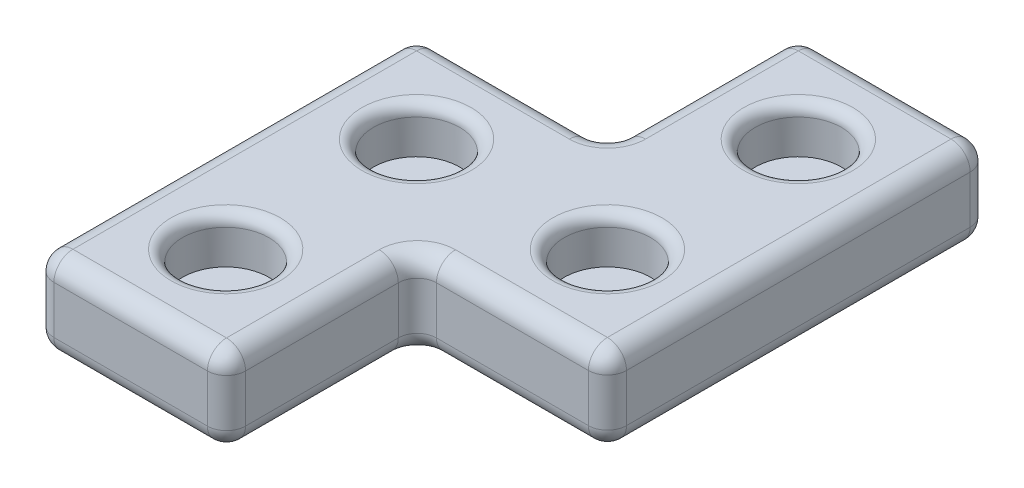
from build123d import *

# Parameters (mm, degrees)
BOSS_EXTRUDE1_DEPTH = 5.715
SKETCH2_R           = 2.8702
CUT_EXTRUDE1_DEPTH  = 3.048
FILLET1_R           = 1.27
FILLET2_R           = 1.27
FILLET3_R           = 0.762


with BuildPart() as part:
    # Sketch1 → Boss-Extrude1 (new body)
    with BuildSketch(Plane(origin=(0, 0, 0), x_dir=(1, 0, 0), z_dir=(0, 1, 0))):
        with BuildLine():
            Line((-7.665886605, 2.665075851), (-7.665886605, 12.825075851))
            ThreePointArc((-7.665886605, 12.825075851), (-7.293912217, 13.723101463), (-6.395886605, 14.095075851))
            Line((-6.395886605, 14.095075851), (3.764113395, 14.095075851))
            ThreePointArc((3.764113395, 14.095075851), (4.662139007, 13.723101463), (5.034113395, 12.825075851))
            Line((5.034113395, 12.825075851), (5.034113395, -10.034924149))
            ThreePointArc((5.034113395, -10.034924149), (4.662139007, -10.932949761), (3.764113395, -11.304924149))
            Line((3.764113395, -11.304924149), (-6.340896914, -11.304924149))
            ThreePointArc((-6.340896914, -11.304924149), (-7.238922526, -11.676898537), (-7.610896914, -12.574924149))
            Line((-7.610896914, -12.574924149), (-7.610896914, -22.734924149))
            ThreePointArc((-7.610896914, -22.734924149), (-7.982871302, -23.632949761), (-8.880896914, -24.004924149))
            Line((-8.880896914, -24.004924149), (-19.095886605, -24.004924149))
            ThreePointArc((-19.095886605, -24.004924149), (-19.993912217, -23.632949761), (-20.365886605, -22.734924149))
            Line((-20.365886605, -22.734924149), (-20.365886605, 0.125075851))
            ThreePointArc((-20.365886605, 0.125075851), (-19.993912217, 1.023101463), (-19.095886605, 1.395075851))
            Line((-19.095886605, 1.395075851), (-8.935886605, 1.395075851))
            ThreePointArc((-8.935886605, 1.395075851), (-8.037860993, 1.767050239), (-7.665886605, 2.665075851))
        make_face()
    extrude(amount=BOSS_EXTRUDE1_DEPTH)

    # Sketch2 → Cut-Extrude1 (cut)
    with BuildSketch(Plane(origin=(0, 5.715, 0), x_dir=(1, 0, 0), z_dir=(0, 1, 0))):
        with Locations((-1.315886605, 7.745075851)):
            Circle(SKETCH2_R)
        with Locations((-14.015886605, -4.954924149)):
            Circle(SKETCH2_R)
        with Locations((-14.015886605, -17.654924149)):
            Circle(SKETCH2_R)
        with Locations((-1.315886605, -4.954924149)):
            Circle(SKETCH2_R)
    extrude(amount=-CUT_EXTRUDE1_DEPTH, mode=Mode.SUBTRACT)

    # Fillet1
    fillet1_edges = [part.edges().sort_by_distance(p)[0] for p in [
        (-1.288391759, 5.715, 11.304924149),
        (-7.610896914, 5.715, 17.654924149),
        (-13.988391759, 5.715, 24.004924149),
        (-20.365886605, 5.715, 11.304924149),
        (-14.015886605, 5.715, -1.395075851),
        (-7.665886605, 5.715, -7.745075851),
        (-1.315886605, 5.715, -14.095075851),
        (5.034113395, 5.715, -1.395075851),
        (4.662139007, 5.715, 10.932949761),
        (-7.238922526, 5.715, 11.676898537),
        (-7.982871302, 5.715, 23.632949761),
        (-19.993912217, 5.715, 23.632949761),
        (-19.993912217, 5.715, -1.023101463),
        (-8.037860993, 5.715, -1.767050239),
        (-7.293912217, 5.715, -13.723101463),
        (4.662139007, 5.715, -13.723101463),
    ]]
    fillet(fillet1_edges, radius=FILLET1_R)

    # Fillet2
    fillet2_edges = [part.edges().sort_by_distance(p)[0] for p in [
        (-1.315886605, 0, -14.095075851),
        (-7.665886605, 0, -7.745075851),
        (-14.015886605, 0, -1.395075851),
        (-20.365886605, 0, 11.304924149),
        (-13.988391759, 0, 24.004924149),
        (-7.610896914, 0, 17.654924149),
        (-1.288391759, 0, 11.304924149),
        (5.034113395, 0, -1.395075851),
        (4.662139007, 0, 10.932949761),
        (-7.238922526, 0, 11.676898537),
        (-7.982871302, 0, 23.632949761),
        (-19.993912217, 0, 23.632949761),
        (-19.993912217, 0, -1.023101463),
        (-8.037860993, 0, -1.767050239),
        (-7.293912217, 0, -13.723101463),
        (4.662139007, 0, -13.723101463),
    ]]
    fillet(fillet2_edges, radius=FILLET2_R)

    # Fillet3
    fillet3_edges = [part.edges().sort_by_distance(p)[0] for p in [
        (-16.886086605, 5.715, 17.654924149),
        (-16.886086605, 5.715, 4.954924149),
        (-4.186086605, 5.715, 4.954924149),
        (-4.186086605, 5.715, -7.745075851),
    ]]
    fillet(fillet3_edges, radius=FILLET3_R)


solid = part.part
